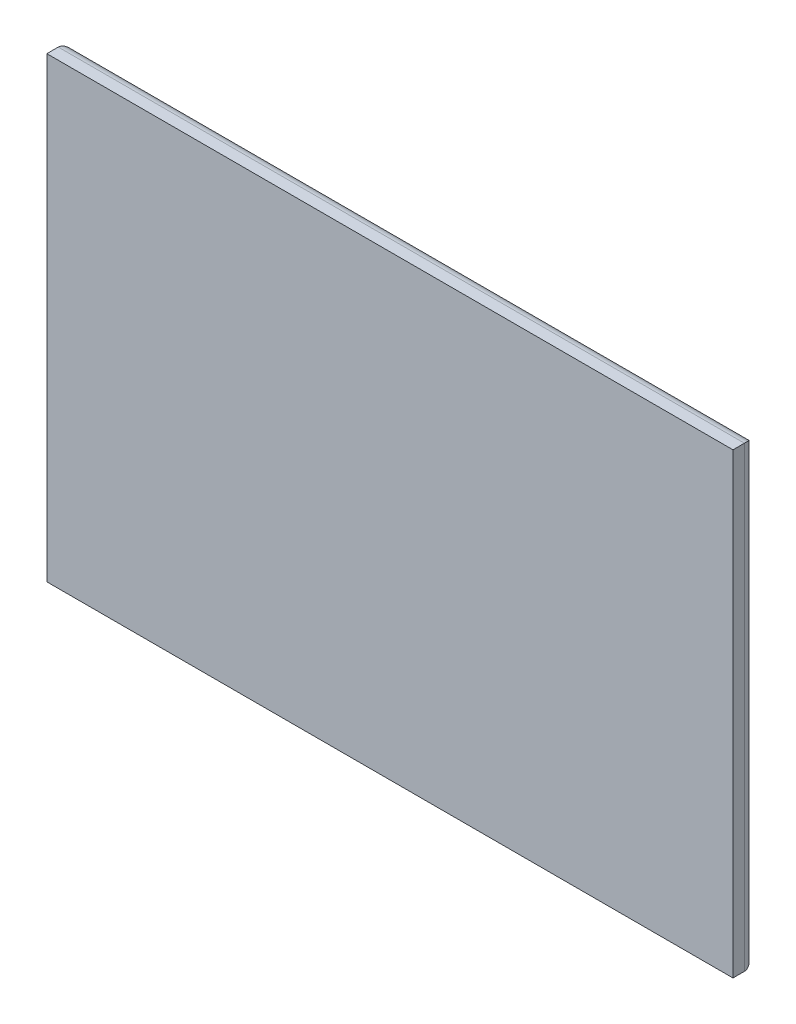
from build123d import *

# Parameters (mm, degrees)
SKETCH1_W           = 60
SKETCH1_H           = 40
BOSS_EXTRUDE1_DEPTH = 2
FILLET1_R           = 1


with BuildPart() as part:
    # Sketch1 → Boss-Extrude1 (new body)
    with BuildSketch(Plane.XY):
        Rectangle(SKETCH1_W, SKETCH1_H)
    extrude(amount=BOSS_EXTRUDE1_DEPTH)

    # Fillet1
    fillet1_edges = [part.edges().sort_by_distance(p)[0] for p in [
        (0, 20, 0),
        (-30, 0, 0),
        (0, -20, 0),
        (30, 0, 0),
    ]]
    fillet(fillet1_edges, radius=FILLET1_R)


solid = part.part
